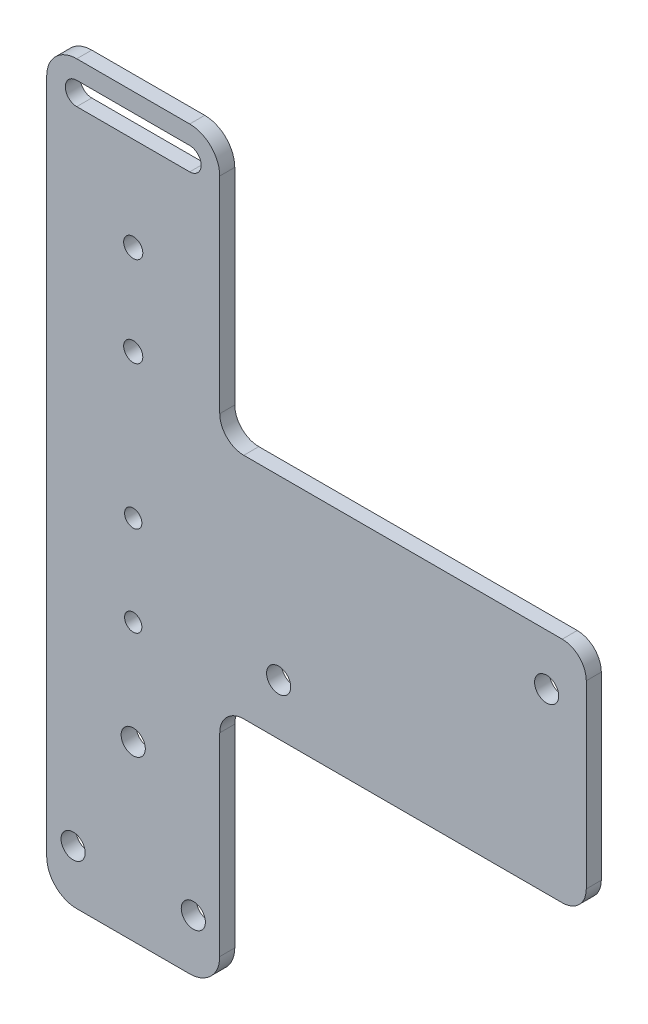
from build123d import *

# Parameters (mm, degrees)
SKETCH1_R           = 2.5527
SKETCH1_R_2         = 1.8288
SKETCH1_R_3         = 2.0193
BOSS_EXTRUDE1_DEPTH = 3.175


with BuildPart() as part:
    # Sketch1 → Boss-Extrude1 (new body)
    with BuildSketch(Plane.XY.offset(1.5875)):
        with BuildLine():
            Line((18.288, -65.0875), (18.288, -24.13))
            ThreePointArc((18.288, -24.13), (19.775897552, -20.537897552), (23.368, -19.05))
            Line((23.368, -19.05), (90.678, -19.05))
            ThreePointArc((90.678, -19.05), (94.270102448, -17.562102448), (95.758, -13.97))
            Line((95.758, -13.97), (95.758, 24.13))
            ThreePointArc((95.758, 24.13), (94.270102448, 27.722102448), (90.678, 29.21))
            Line((90.678, 29.21), (23.368, 29.21))
            ThreePointArc((23.368, 29.21), (19.775897552, 30.697897552), (18.288, 34.29))
            Line((18.288, 34.29), (18.288, 77.7875))
            ThreePointArc((18.288, 77.7875), (16.428128061, 82.277628061), (11.938, 84.1375))
            Line((11.938, 84.1375), (-11.938, 84.1375))
            ThreePointArc((-11.938, 84.1375), (-16.428128061, 82.277628061), (-18.288, 77.7875))
            Line((-18.288, 77.7875), (-18.288, -65.0875))
            ThreePointArc((-18.288, -65.0875), (-16.428128061, -69.577628061), (-11.938, -71.4375))
            Line((-11.938, -71.4375), (11.938, -71.4375))
            ThreePointArc((11.938, -71.4375), (16.428128061, -69.577628061), (18.288, -65.0875))
        make_face()
        with Locations((87.376, 18.415)):
            Circle(SKETCH1_R, mode=Mode.SUBTRACT)
        with Locations((30.734, -8.255)):
            Circle(SKETCH1_R, mode=Mode.SUBTRACT)
        with Locations((0, -13.0175)):
            Circle(SKETCH1_R_2, mode=Mode.SUBTRACT)
        with Locations((0, 6.0325)):
            Circle(SKETCH1_R_2, mode=Mode.SUBTRACT)
        with Locations((0, 36.5125)):
            Circle(SKETCH1_R_3, mode=Mode.SUBTRACT)
        with Locations((0, 55.5625)):
            Circle(SKETCH1_R_3, mode=Mode.SUBTRACT)
        with Locations((12.7, -60.325)):
            Circle(SKETCH1_R, mode=Mode.SUBTRACT)
        with Locations((-12.7, -60.325)):
            Circle(SKETCH1_R, mode=Mode.SUBTRACT)
        with Locations((0, -34.925)):
            Circle(SKETCH1_R, mode=Mode.SUBTRACT)
        with BuildLine():
            Line((-11.938, 80.2005), (11.938, 80.2005))
            ThreePointArc((11.938, 80.2005), (14.351, 77.7875), (11.938, 75.3745))
            Line((11.938, 75.3745), (-11.938, 75.3745))
            ThreePointArc((-11.938, 75.3745), (-14.351, 77.7875), (-11.938, 80.2005))
        make_face(mode=Mode.SUBTRACT)
    extrude(amount=-BOSS_EXTRUDE1_DEPTH)


solid = part.part
